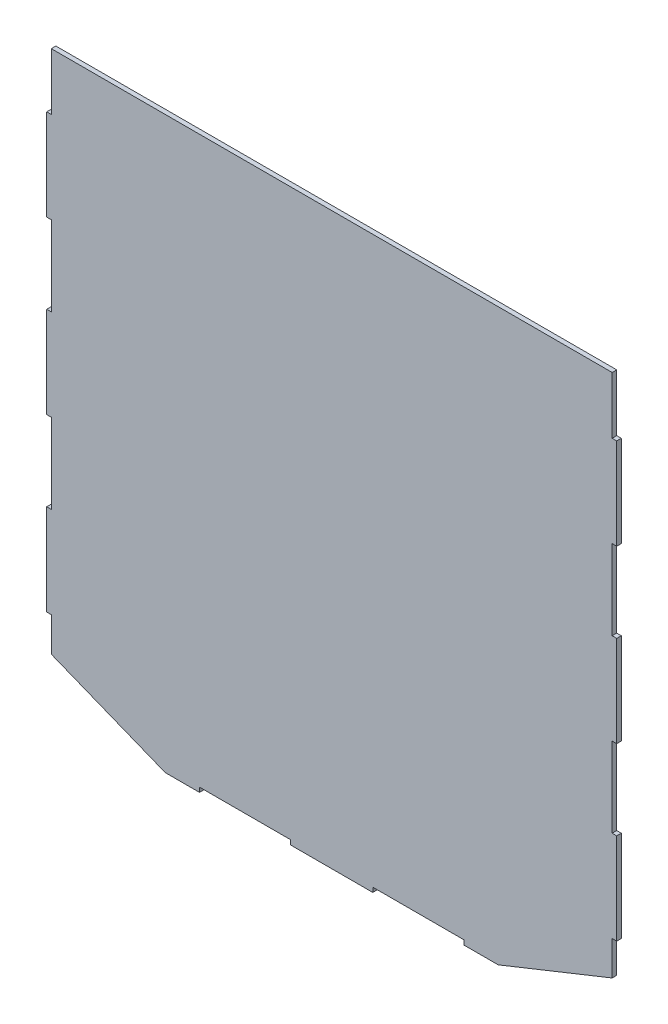
from build123d import *

# Parameters (mm, degrees)
BOSS_EXTRUDE1_DEPTH = 2


with BuildPart() as part:
    # Sketch1 → Boss-Extrude1 (new body)
    with BuildSketch(Plane.XY):
        Polygon((-123, 35), (-123, 20), (-73, 0), (-58, 0), (-58, 2), (-18, 2), (-18, 0), (18, 0), (18, 2), (58, 2), (58, 0), (73, 0), (123, 20), (123, 35), (125, 35), (125, 75), (123, 75), (123, 110), (125, 110), (125, 150), (123, 150), (123, 185), (125, 185), (125, 225), (123, 225), (123, 250), (-123, 250), (-123, 225), (-125, 225), (-125, 185), (-123, 185), (-123, 150), (-125, 150), (-125, 110), (-123, 110), (-123, 75), (-125, 75), (-125, 35), align=None)
    extrude(amount=BOSS_EXTRUDE1_DEPTH)


solid = part.part
